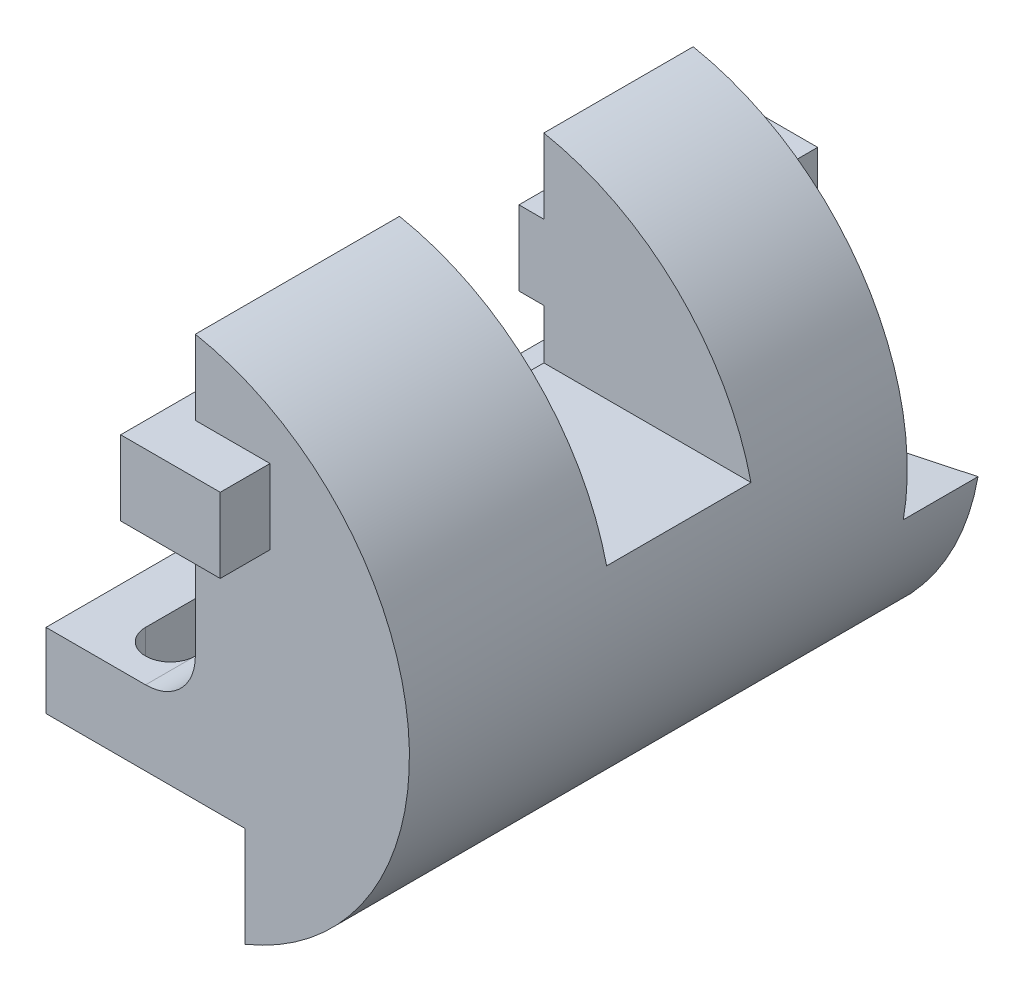
from build123d import *

# Parameters (mm, degrees)
BOSS_EXTRUDE1_DEPTH            = 100
BOSS_EXTRUDE2_START            = 15
BOSS_EXTRUDE2_DEPTH            = 15
CUT_EXTRUDE1_REACH             = 129.299
CUT_EXTRUDE1_DIRECTION_2_DEPTH = 128.298860953
BOSS_EXTRUDE3_DEPTH            = 10
BOSS_EXTRUDE3_DEPTH_BACK       = 110
SKETCH5_W                      = 20
SKETCH5_H                      = 15
CUT_EXTRUDE2_DEPTH             = 136.295971854
CUT_EXTRUDE2_DEPTH_BACK        = 136.295971854
SKETCH6_W                      = 29
SKETCH6_H                      = 40
FILLET1_R                      = 10


with BuildPart() as part:
    # Sketch1 → Boss-Extrude1 (new body)
    with BuildSketch(Plane.XY):
        with BuildLine():
            Line((10, -35.129619486), (10, -15))
            Line((10, -15), (-30, -15))
            Line((-30, -15), (-30, 0))
            Line((-30, 0), (0, 0))
            Line((0, 0), (0, 66))
            ThreePointArc((0, 66), (42.742771868, 19.167308707), (10, -35.129619486))
        make_face()
    extrude(amount=BOSS_EXTRUDE1_DEPTH)

    # Sketch2 → Boss-Extrude2 (add)
    with BuildSketch(Plane(origin=(0, 0, 0), x_dir=(-1, 0, 0), z_dir=(0, 0, -1)).offset(BOSS_EXTRUDE2_START)):
        with BuildLine():
            Line((30, -15), (30, -10.52909236))
            Line((30, -10.52909236), (-42.207179875, 4.819017522))
            ThreePointArc((-42.207179875, 4.819017522), (-31.260666573, -19.313012165), (-10, -35.129619486))
            Line((-10, -35.129619486), (-10, -15))
            Line((-10, -15), (30, -15))
        make_face()
    extrude(amount=-BOSS_EXTRUDE2_DEPTH)

    # Sketch4 → Cut-Extrude1 (cut, up to next)
    with BuildSketch(Plane(origin=(0, 0, 0), x_dir=(1, 0, 0), z_dir=(0, 1, 0)), mode=Mode.PRIVATE) as cut_extrude1_sk1:
        with BuildLine():
            Line((-20, -10), (-20, -90))
            ThreePointArc((-20, -90), (-15, -95), (-10, -90))
            Line((-10, -90), (-10, -10))
            ThreePointArc((-10, -10), (-15, -5), (-20, -10))
        make_face()
    cut_extrude1_tool1 = extrude(cut_extrude1_sk1.sketch, amount=-CUT_EXTRUDE1_REACH, mode=Mode.PRIVATE) & part.part
    add(cut_extrude1_tool1.solids().sort_by_distance((-15, 0, 50))[0], mode=Mode.SUBTRACT)

    # Sketch4 → Cut-Extrude1 direction 2 (cut)
    with BuildSketch(Plane(origin=(0, 0, 0), x_dir=(1, 0, 0), z_dir=(0, 1, 0))):
        with BuildLine():
            Line((-20, -10), (-20, -90))
            ThreePointArc((-20, -90), (-15, -95), (-10, -90))
            Line((-10, -90), (-10, -10))
            ThreePointArc((-10, -10), (-15, -5), (-20, -10))
        make_face()
    extrude(amount=CUT_EXTRUDE1_DIRECTION_2_DEPTH, mode=Mode.SUBTRACT)

    # Sketch5 → Boss-Extrude3 (add, two sides: drawn at the far end of the back side and taken through both)
    with BuildSketch(Plane.XY.offset(100).offset(-BOSS_EXTRUDE3_DEPTH_BACK)):
        with Locations((5, 43.5)):
            Rectangle(SKETCH5_W, SKETCH5_H)
    extrude(amount=BOSS_EXTRUDE3_DEPTH + BOSS_EXTRUDE3_DEPTH_BACK)

    # Sketch6 → Cut-Extrude2 (cut, two sides: drawn at the far end of the back side and taken through both)
    with BuildSketch(Plane.ZY.offset(-CUT_EXTRUDE2_DEPTH_BACK)):
        with Locations((44.5, 46)):
            Rectangle(SKETCH6_W, SKETCH6_H)
    extrude(amount=CUT_EXTRUDE2_DEPTH + CUT_EXTRUDE2_DEPTH_BACK, mode=Mode.SUBTRACT)

    # Fillet1
    fillet1_edges = [part.edges().sort_by_distance(p)[0] for p in [
        (0, 0, 50),
    ]]
    fillet(fillet1_edges, radius=FILLET1_R - 0.0001)  # a hair under: the kernel refuses the full size


solid = part.part
